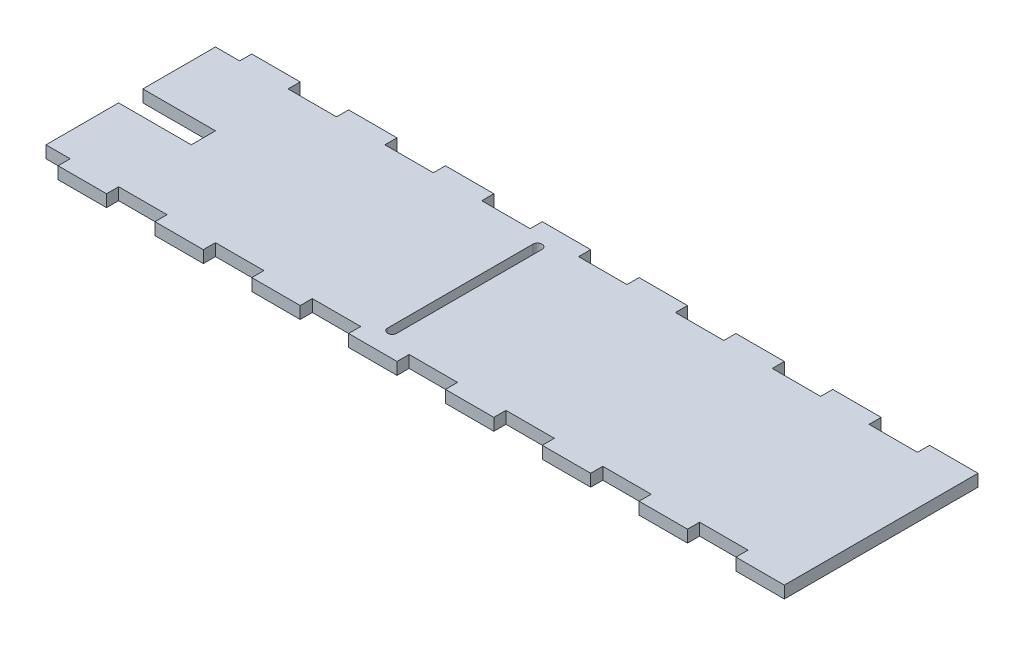
from build123d import *

# Parameters (mm, degrees)
BOSS_EXTRUDE1_DEPTH = 3.175
SKETCH2_W           = 12.7
SKETCH2_H           = 6.35
CUT_EXTRUDE1_DEPTH  = 198.182581951
SKETCH3_W           = 19.05
SKETCH3_H           = 3.175
BOSS_EXTRUDE2_DEPTH = 6.35
CUT_EXTRUDE4_DEPTH  = 3.175
SKETCH6_W           = 3.74
SKETCH6_H           = 38.1
BOSS_EXTRUDE3_DEPTH = 2.54
FILLET1_R           = 5.08
CUT_EXTRUDE5_REACH  = 113.371
SKETCH7_W           = 29.301181898
SKETCH7_H           = 1.2
FILLET3_R           = 2.54


with BuildPart() as part:
    # Sketch1 → Boss-Extrude1 (new body)
    with BuildSketch(Plane(origin=(0, 0, 0), x_dir=(1, 0, 0), z_dir=(0, 1, 0))):
        Polygon((12.7, 0), (0, 0), (0, -50.8), (12.7, -50.8), (12.7, -47.625), (25.4, -47.625), (25.4, -50.8), (38.1, -50.8), (38.1, -47.625), (50.8, -47.625), (50.8, -50.8), (63.5, -50.8), (63.5, -47.625), (76.2, -47.625), (76.2, -50.8), (88.9, -50.8), (88.9, -47.625), (101.6, -47.625), (101.6, -50.8), (114.3, -50.8), (114.3, -47.625), (127, -47.625), (127, -50.8), (139.7, -50.8), (139.7, -47.625), (152.4, -47.625), (152.4, -50.8), (165.1, -50.8), (165.1, -47.625), (177.8, -47.625), (177.8, -50.8), (190.5, -50.8), (190.5, 0), (177.8, 0), (177.8, -3.175), (165.1, -3.175), (165.1, 0), (152.4, 0), (152.4, -3.175), (139.7, -3.175), (139.7, 0), (127, 0), (127, -3.175), (114.3, -3.175), (114.3, 0), (101.6, 0), (101.6, -3.175), (88.9, -3.175), (88.9, 0), (76.2, 0), (76.2, -3.175), (63.5, -3.175), (63.5, 0), (50.8, 0), (50.8, -3.175), (38.1, -3.175), (38.1, 0), (25.4, 0), (25.4, -3.175), (12.7, -3.175), align=None)
    extrude(amount=BOSS_EXTRUDE1_DEPTH)

    # Sketch2 → Cut-Extrude1 (cut, through all)
    with BuildSketch(Plane(origin=(0, 3.175, 0), x_dir=(1, 0, 0), z_dir=(0, 1, 0))):
        with Locations((6.35, -25.4)):
            Rectangle(SKETCH2_W, SKETCH2_H)
    extrude(amount=-CUT_EXTRUDE1_DEPTH, mode=Mode.SUBTRACT)

    # Sketch3 → Boss-Extrude2 (add)
    with BuildSketch(Plane.ZY):
        with Locations((12.7, 1.5875)):
            Rectangle(SKETCH3_W, SKETCH3_H)
        with Locations((38.1, 1.5875)):
            Rectangle(SKETCH3_W, SKETCH3_H)
    extrude(amount=BOSS_EXTRUDE2_DEPTH)

    # Sketch5 → Cut-Extrude4 (cut)
    with BuildSketch(Plane(origin=(0, 3.175, 0), x_dir=(1, 0, 0), z_dir=(0, 1, 0))):
        with BuildLine():
            Line((82.48, -6.35), (82.48, -44.45))
            ThreePointArc((82.48, -44.45), (81.28, -45.65), (80.08, -44.45))
            Line((80.08, -44.45), (80.08, -6.35))
            ThreePointArc((80.08, -6.35), (81.28, -5.15), (82.48, -6.35))
        make_face()
    extrude(amount=-CUT_EXTRUDE4_DEPTH, mode=Mode.SUBTRACT)

    # Sketch6 → Boss-Extrude3 (add)
    with BuildSketch(Plane(origin=(0, 0, 0), x_dir=(-1, 0, 0), z_dir=(0, -1, 0))):
        with Locations((-106.01, -25.4)):
            Rectangle(SKETCH6_W, SKETCH6_H)
        with Locations((-93.31, -25.4)):
            Rectangle(SKETCH6_W, SKETCH6_H)
        with Locations((-118.71, -25.4)):
            Rectangle(SKETCH6_W, SKETCH6_H)
        with Locations((-131.41, -25.4)):
            Rectangle(SKETCH6_W, SKETCH6_H)
        with Locations((-144.11, -25.4)):
            Rectangle(SKETCH6_W, SKETCH6_H)
    extrude(amount=BOSS_EXTRUDE3_DEPTH)

    # Fillet1
    # the kernel refuses this fillet: 5.08 mm, written as the material it takes off along each edge
    with BuildSketch(Plane(origin=(106.178522628, -2.54, 6.35), x_dir=(0, 1, 0), z_dir=(-1, 0, 0)), Plane(origin=(80.441477372, -2.54, 44.45), x_dir=(0, 1, 0), z_dir=(1, 0, 0))) as fillet1_piece_1:
        with BuildLine():
            CenterArc((5.08, -4.399409051), FILLET1_R, 120, 60)
            Line((0, -4.399409051), (-0.1016, -4.399409051))
            Line((-0.1016, -4.399409051), (-0.1016, 0))
            Line((-0.1016, 0), (0, 0.1016))
            ThreePointArc((0, 0.1016), (1.27, 0.1016), (2.4892, 0.087988181))
            Line((2.4892, 0.087988181), (2.54, 0))
        make_face()
    extrude(amount=25.737045256, mode=Mode.SUBTRACT)
    with BuildSketch(Plane(origin=(93.141477372, -2.54, 6.35), x_dir=(0, 1, 0), z_dir=(1, 0, 0)), Plane(origin=(105.841477372, -2.54, 6.35), x_dir=(0, 1, 0), z_dir=(1, 0, 0)), Plane(origin=(118.541477372, -2.54, 6.35), x_dir=(0, 1, 0), z_dir=(1, 0, 0)), Plane(origin=(131.241477372, -2.54, 6.35), x_dir=(0, 1, 0), z_dir=(1, 0, 0)), Plane(origin=(156.978522628, -2.54, 44.45), x_dir=(0, 1, 0), z_dir=(-1, 0, 0)), Plane(origin=(144.278522628, -2.54, 44.45), x_dir=(0, 1, 0), z_dir=(-1, 0, 0)), Plane(origin=(131.578522628, -2.54, 44.45), x_dir=(0, 1, 0), z_dir=(-1, 0, 0)), Plane(origin=(118.878522628, -2.54, 44.45), x_dir=(0, 1, 0), z_dir=(-1, 0, 0))) as fillet1_piece_2:
        with BuildLine():
            CenterArc((5.08, 4.399409051), FILLET1_R, 180, 60)
            Line((0, 4.399409051), (-0.1016, 4.399409051))
            Line((-0.1016, 4.399409051), (-0.1016, 0))
            Line((-0.1016, 0), (0, -0.1016))
            ThreePointArc((0, -0.1016), (1.27, -0.1016), (2.4892, -0.087988181))
            Line((2.4892, -0.087988181), (2.54, 0))
        make_face()
    extrude(amount=25.737045256, mode=Mode.SUBTRACT)

    # Cut-Extrude5: up to this face of the body (flat: up to its plane)
    cut_extrude5_end = Plane(part.part.faces().sort_by_distance((145.98, -1.229881831, 25.4))[0])
    # Sketch7 → Cut-Extrude5 (cut, up to the picked face)
    with BuildSketch(Plane.ZY.offset(-91.44), mode=Mode.PRIVATE) as cut_extrude5_sk1:
        with Locations((25.4, -0.6)):
            Rectangle(SKETCH7_W, SKETCH7_H)
    cut_extrude5_tool1 = split(extrude(cut_extrude5_sk1.sketch, amount=-CUT_EXTRUDE5_REACH, mode=Mode.PRIVATE), bisect_by=cut_extrude5_end, keep=Keep.BOTH, mode=Mode.PRIVATE)
    add(cut_extrude5_tool1.solids().sort_by(Axis((91.44, -0.6, 25.4), (1, 0, 0)))[0], mode=Mode.SUBTRACT)

    # Fillet3
    # the kernel refuses this fillet: 2.54 mm, written as the material it adds along each edge
    with BuildSketch(Plane(origin=(120.58, 0, 6.35), x_dir=(0, 0, -1), z_dir=(-1, 0, 0)), Plane(origin=(116.84, 0, 44.45), x_dir=(0, 0, 1), z_dir=(1, 0, 0)), Plane(origin=(107.88, 0, 6.35), x_dir=(0, 0, -1), z_dir=(-1, 0, 0)), Plane(origin=(104.14, 0, 44.45), x_dir=(0, 0, 1), z_dir=(1, 0, 0)), Plane(origin=(95.18, 0, 6.35), x_dir=(0, 0, -1), z_dir=(-1, 0, 0)), Plane(origin=(91.44, 0, 44.45), x_dir=(0, 0, 1), z_dir=(1, 0, 0)), Plane(origin=(145.98, 0, 6.35), x_dir=(0, 0, -1), z_dir=(-1, 0, 0)), Plane(origin=(142.24, 0, 44.45), x_dir=(0, 0, 1), z_dir=(1, 0, 0)), Plane(origin=(133.28, 0, 6.35), x_dir=(0, 0, -1), z_dir=(-1, 0, 0)), Plane(origin=(129.54, 0, 44.45), x_dir=(0, 0, 1), z_dir=(1, 0, 0))) as fillet3_piece_1:
        with BuildLine():
            CenterArc((1.280203612, 2.54), FILLET3_R, 221.810314896, 48.189685104)
            ThreePointArc((-0.613000609, 0.846666667), (-0.284665667, 0.439141971), (0, 0))
            Line((0, 0), (1.280203612, 0))
        make_face()
    extrude(amount=3.74)


solid = part.part
